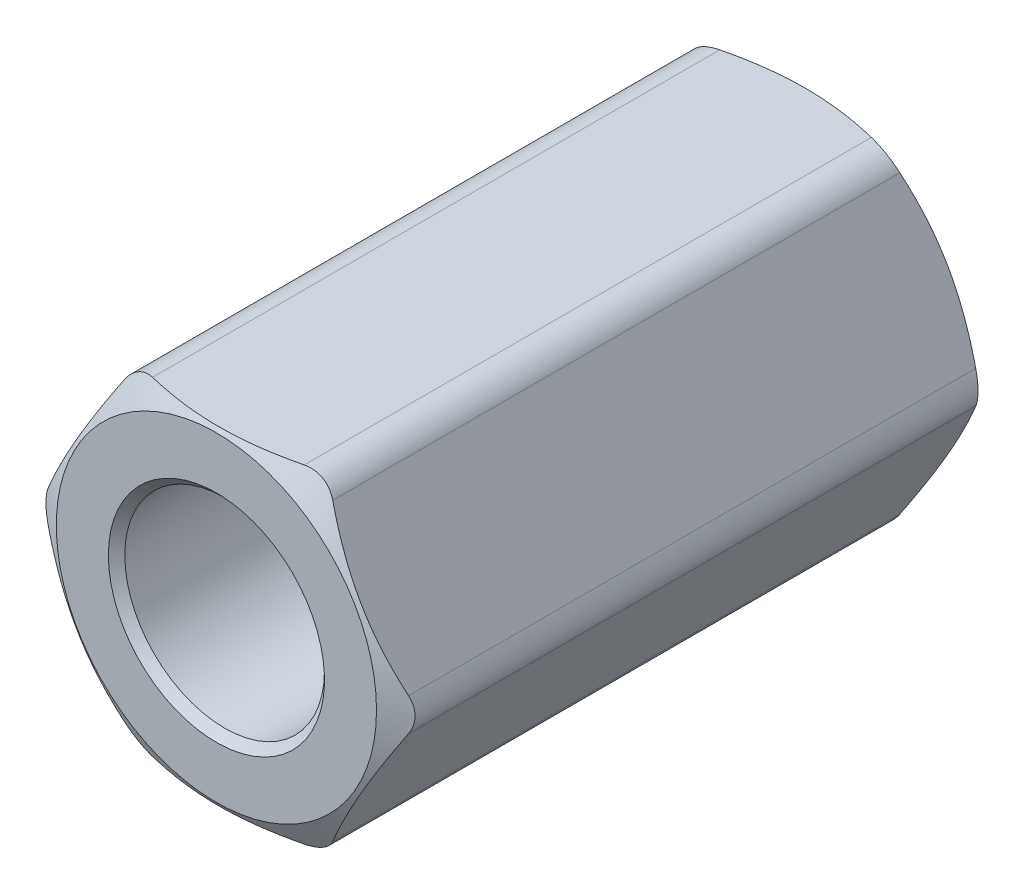
from build123d import *

# Parameters (mm, degrees)
SKETCH4_R           = 3.190875
BOSS_EXTRUDE1_DEPTH = 7.14375
SKETCH5_OUTSIDE_W   = 72.142
SKETCH5_OUTSIDE_H   = 70.914
SKETCH5_OUTSIDE_R   = 3.86953125
CUT_EXTRUDE1_DEPTH  = 16.520468256
CUT_EXTRUDE1_DRAFT  = -60
SKETCH6_OUTSIDE_W   = 72.142
SKETCH6_OUTSIDE_H   = 70.914
SKETCH6_OUTSIDE_R   = 3.86953125
CUT_EXTRUDE2_DEPTH  = 16.520468256
CUT_EXTRUDE2_DRAFT  = -60
FILLET1_R           = 0.79375


with BuildPart() as part:
    # Sketch3 → Revolve1 (revolve)
    with BuildSketch(Plane(origin=(0, 0, 0), x_dir=(0, 0, -1), z_dir=(1, 0, 0)), mode=Mode.PRIVATE) as revolve1_sk:
        Polygon((7.14375, 2.6114375), (7.14375, 3.96875), (0, 3.96875), (-7.14375, 3.96875), (-7.14375, 2.6114375), (-6.9453125, 2.413), (6.9453125, 2.413), align=None)
        Polygon((7.14375, 2.6114375), (7.14375, 3.96875), (0, 3.96875), (-7.14375, 3.96875), (-7.14375, 2.6114375), (-6.9453125, 2.413), (6.9453125, 2.413), align=None)
    revolve(revolve1_sk.sketch.rotate(Axis((0, 0, -7.14375), (0, 0, 1)), 90), axis=Axis((0, 0, -7.14375), (0, 0, 1)))

    # Sketch4 → Boss-Extrude1 (add, symmetric)
    with BuildSketch(Plane.XY):
        Polygon((-2.291358881, 3.96875), (-4.582717762, 0), (-2.291358881, -3.96875), (2.291358881, -3.96875), (4.582717762, 0), (2.291358881, 3.96875), align=None)
        Circle(SKETCH4_R, mode=Mode.SUBTRACT)
    extrude(amount=BOSS_EXTRUDE1_DEPTH, both=True)


with BuildPart() as cut_extrude1_tool:
    # Sketch5 outside → Cut-Extrude1 (with draft: the straight prism first)
    with BuildSketch(Plane.XY.offset(7.14375)):
        Rectangle(SKETCH5_OUTSIDE_W, SKETCH5_OUTSIDE_H)
        Circle(SKETCH5_OUTSIDE_R, mode=Mode.SUBTRACT)
    extrude(amount=-CUT_EXTRUDE1_DEPTH)
    # Cut-Extrude1: the draft: its side faces are tilted about the plane it starts from
    cut_extrude1_sides = [cut_extrude1_tool.faces().sort_by_distance(p)[0] for p in [
        (0, -35.457, -1.116484128),
        (36.071, 0, -1.116484128),
        (0, 35.457, -1.116484128),
        (-36.071, 0, -1.116484128),
        (-3.86953125, 0, -1.116484128),
    ]]
    draft(cut_extrude1_sides, Plane.XY.offset(7.14375), CUT_EXTRUDE1_DRAFT)


with BuildPart() as part_1:
    add(part.part)

    # Cut-Extrude1: cut by cut_extrude1_tool
    add(cut_extrude1_tool.part, mode=Mode.SUBTRACT)


with BuildPart() as cut_extrude2_tool:
    # Sketch6 outside → Cut-Extrude2 (with draft: the straight prism first)
    with BuildSketch(Plane(origin=(0, 0, -7.14375), x_dir=(-1, 0, 0), z_dir=(0, 0, -1))):
        Rectangle(SKETCH6_OUTSIDE_W, SKETCH6_OUTSIDE_H)
        Circle(SKETCH6_OUTSIDE_R, mode=Mode.SUBTRACT)
    extrude(amount=-CUT_EXTRUDE2_DEPTH)
    # Cut-Extrude2: the draft: its side faces are tilted about the plane it starts from
    cut_extrude2_sides = [cut_extrude2_tool.faces().sort_by_distance(p)[0] for p in [
        (0, -35.457, 1.116484128),
        (-36.071, 0, 1.116484128),
        (0, 35.457, 1.116484128),
        (36.071, 0, 1.116484128),
        (3.86953125, 0, 1.116484128),
    ]]
    draft(cut_extrude2_sides, Plane(origin=(0, 0, -7.14375), x_dir=(-1, 0, 0), z_dir=(0, 0, -1)), CUT_EXTRUDE2_DRAFT)


with BuildPart() as part_2:
    add(part_1.part)

    # Cut-Extrude2: cut by cut_extrude2_tool
    add(cut_extrude2_tool.part, mode=Mode.SUBTRACT)

    # Fillet1
    # the kernel refuses this fillet: 0.79375 mm, written as the material it takes off along each edge
    with BuildSketch(Plane(origin=(2.291358881, 3.96875, 7.877671016), x_dir=(0.49999999999999933, -0.866025403784439, 0), z_dir=(0, 0, -1)), Plane(origin=(-4.582717762, 0, -7.877671016), x_dir=(0.5000000000000004, -0.8660254037844384, 0), z_dir=(0, 0, 1)), Plane(origin=(4.582717762, 0, 7.877671016), x_dir=(-0.49999999999999917, -0.8660254037844392, 0), z_dir=(0, 0, -1)), Plane(origin=(-2.291358881, 3.96875, 7.877671016), x_dir=(1, 0, 0), z_dir=(0, 0, -1))) as fillet1_piece_1:
        with BuildLine():
            CenterArc((FILLET1_R * 0.57735026919, FILLET1_R), FILLET1_R, 210, 60)
            Line((-FILLET1_R * 0.288675134595, FILLET1_R * 0.5), (0, 0))
            Line((0, 0), (FILLET1_R * 0.57735026919, 0))
        make_face()
    extrude(amount=15.755342032, mode=Mode.SUBTRACT)
    with BuildSketch(Plane(origin=(-2.291358881, -3.96875, -7.877671016), x_dir=(-0.5000000000000001, 0.8660254037844386, 0), z_dir=(0, 0, 1)), Plane(origin=(2.291358881, -3.96875, -7.877671016), x_dir=(-1, 0, 0), z_dir=(0, 0, 1))) as fillet1_piece_2:
        with BuildLine():
            CenterArc((FILLET1_R * 0.57735026919, -FILLET1_R), FILLET1_R, 90, 60)
            Line((-FILLET1_R * 0.288675134595, -FILLET1_R * 0.5), (0, 0))
            Line((0, 0), (FILLET1_R * 0.57735026919, 0))
        make_face()
    extrude(amount=15.755342032, mode=Mode.SUBTRACT)


solid = part_2.part
